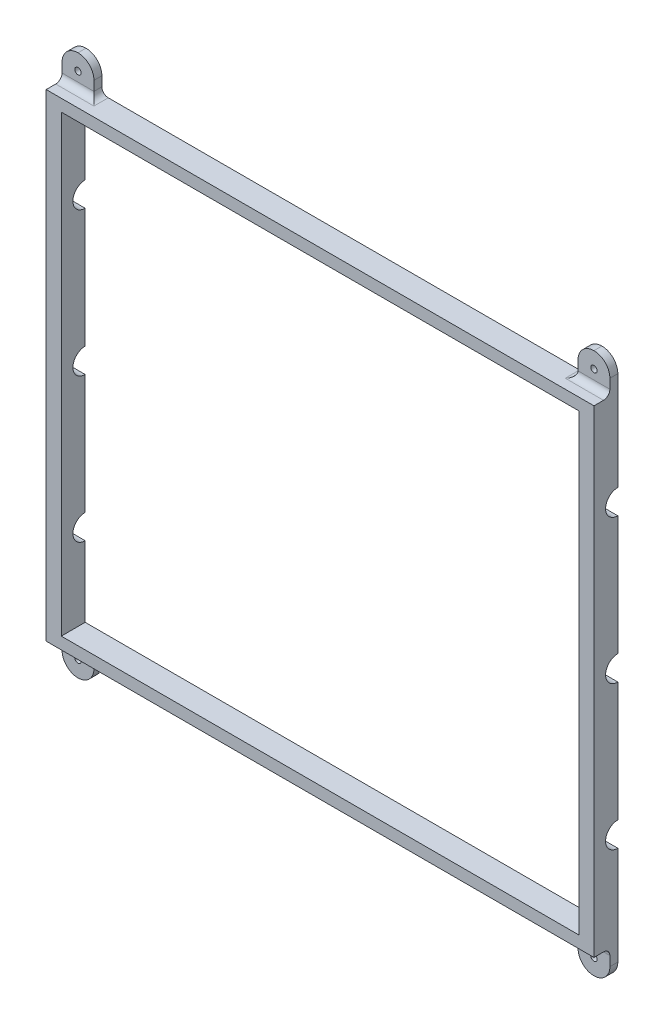
from build123d import *

# Parameters (mm, degrees)
SKETCH1_W            = 218.44
SKETCH1_H            = 190.5
BOSS_EXTRUDE1_DEPTH  = 9.525
SKETCH2_W            = 206.375
SKETCH2_H            = 180.975
CUT_EXTRUDE1_DEPTH   = 9.525
SKETCH3_R            = 4.8895
CUT_EXTRUDE2_DEPTH   = 239.49386098
SKETCH4_W            = 12.7
SKETCH4_H            = 12.7
BOSS_EXTRUDE2_DEPTH  = 3.175
SKETCH5_R            = 1.27
CUT_EXTRUDE3_DEPTH   = 154.69623743
FILLET1_R            = 6.35
FILLET2_R            = 2.54
FILLET1_OF_MIRROR1_R = 6.35
FILLET2_OF_MIRROR1_R = 2.54
SKETCH6_W            = 12.7
SKETCH6_H            = 12.7
SKETCH6_R            = 1.27
BOSS_EXTRUDE3_DEPTH  = 3.175
FILLET3_R            = 2.54
FILLET4_R            = 6.35
FILLET3_OF_MIRROR7_R = 2.54
FILLET4_OF_MIRROR7_R = 6.35


with BuildPart() as part:
    # Sketch1 → Boss-Extrude1 (new body)
    with BuildSketch(Plane.XY):
        Rectangle(SKETCH1_W, SKETCH1_H)
    extrude(amount=BOSS_EXTRUDE1_DEPTH)

    # Sketch2 → Cut-Extrude1 (cut)
    with BuildSketch(Plane.XY.offset(9.525)):
        Rectangle(SKETCH2_W, SKETCH2_H)
    extrude(amount=-CUT_EXTRUDE1_DEPTH, mode=Mode.SUBTRACT)

    # Sketch3 → Cut-Extrude2 (cut, through all)
    with BuildSketch(Plane(origin=(109.22, 0, 0), x_dir=(0, 0, -1), z_dir=(1, 0, 0))):
        Circle(SKETCH3_R)
        with Locations((0, 57.404)):
            Circle(SKETCH3_R)
        with Locations((0, -57.404)):
            Circle(SKETCH3_R)
    extrude(amount=-CUT_EXTRUDE2_DEPTH, mode=Mode.SUBTRACT)

    # Sketch4 → Boss-Extrude2 (add)
    with BuildSketch(Plane(origin=(0, 0, 0), x_dir=(-1, 0, 0), z_dir=(0, 0, -1))):
        with Locations((-102.87, 101.6)):
            Rectangle(SKETCH4_W, SKETCH4_H)
    boss_extrude2 = extrude(amount=-BOSS_EXTRUDE2_DEPTH)

    # Sketch5 → Cut-Extrude3 (cut, through all)
    with BuildSketch(Plane.XY.offset(3.175)):
        with Locations((102.87, 101.6)):
            Circle(SKETCH5_R)
    cut_extrude3 = extrude(amount=-CUT_EXTRUDE3_DEPTH, mode=Mode.SUBTRACT)

    # Fillet1
    fillet1_edges = [part.edges().sort_by_distance(p)[0] for p in [
        (96.52, 107.95, 1.5875),
        (109.22, 107.95, 1.5875),
    ]]
    fillet(fillet1_edges, radius=FILLET1_R - 0.0001)  # a hair under: the kernel refuses the full size

    # Fillet2
    fillet2_edges = [part.edges().sort_by_distance(p)[0] for p in [
        (102.87, 95.25, 3.175),
        (96.52, 95.25, 1.5875),
    ]]
    fillet(fillet2_edges, radius=FILLET2_R)

    # Mirror1: Boss-Extrude2, Cut-Extrude3 across plane
    add(boss_extrude2.mirror(Plane(origin=(0, 0, 0), x_dir=(0, 0, 1), z_dir=(1, 0, 0))))
    add(cut_extrude3.mirror(Plane(origin=(0, 0, 0), x_dir=(0, 0, 1), z_dir=(1, 0, 0))), mode=Mode.SUBTRACT)

    # Fillet1 of Mirror1
    fillet1_of_mirror1_edges = [part.edges().sort_by_distance(p)[0] for p in [
        (-96.52, 107.95, 1.5875),
        (-109.22, 107.95, 1.5875),
    ]]
    fillet(fillet1_of_mirror1_edges, radius=FILLET1_OF_MIRROR1_R - 0.0001)  # a hair under: the kernel refuses the full size

    # Fillet2 of Mirror1
    fillet2_of_mirror1_edges = [part.edges().sort_by_distance(p)[0] for p in [
        (-102.87, 95.25, 3.175),
        (-96.52, 95.25, 1.5875),
    ]]
    fillet(fillet2_of_mirror1_edges, radius=FILLET2_OF_MIRROR1_R)

    # Sketch6 → Boss-Extrude3 (add)
    with BuildSketch(Plane(origin=(0, 0, 0), x_dir=(-1, 0, 0), z_dir=(0, 0, -1))):
        with Locations((-102.87, -101.6)):
            Rectangle(SKETCH6_W, SKETCH6_H)
        with Locations((-102.87, -101.6)):
            Circle(SKETCH6_R, mode=Mode.SUBTRACT)
    boss_extrude3 = extrude(amount=-BOSS_EXTRUDE3_DEPTH)

    # Fillet3
    fillet3_edges = [part.edges().sort_by_distance(p)[0] for p in [
        (102.87, -95.25, 3.175),
        (96.52, -95.25, 1.5875),
    ]]
    fillet(fillet3_edges, radius=FILLET3_R)

    # Fillet4
    fillet4_edges = [part.edges().sort_by_distance(p)[0] for p in [
        (109.22, -107.95, 1.5875),
        (96.52, -107.95, 1.5875),
    ]]
    fillet(fillet4_edges, radius=FILLET4_R - 0.0001)  # a hair under: the kernel refuses the full size

    # Mirror7: Boss-Extrude3 across plane
    add(boss_extrude3.mirror(Plane(origin=(0, 0, 0), x_dir=(0, 0, 1), z_dir=(1, 0, 0))))

    # Fillet3 of Mirror7
    fillet3_of_mirror7_edges = [part.edges().sort_by_distance(p)[0] for p in [
        (-102.87, -95.25, 3.175),
        (-96.52, -95.25, 1.5875),
    ]]
    fillet(fillet3_of_mirror7_edges, radius=FILLET3_OF_MIRROR7_R)

    # Fillet4 of Mirror7
    fillet4_of_mirror7_edges = [part.edges().sort_by_distance(p)[0] for p in [
        (-109.22, -107.95, 1.5875),
        (-96.52, -107.95, 1.5875),
    ]]
    fillet(fillet4_of_mirror7_edges, radius=FILLET4_OF_MIRROR7_R - 0.0001)  # a hair under: the kernel refuses the full size


solid = part.part
